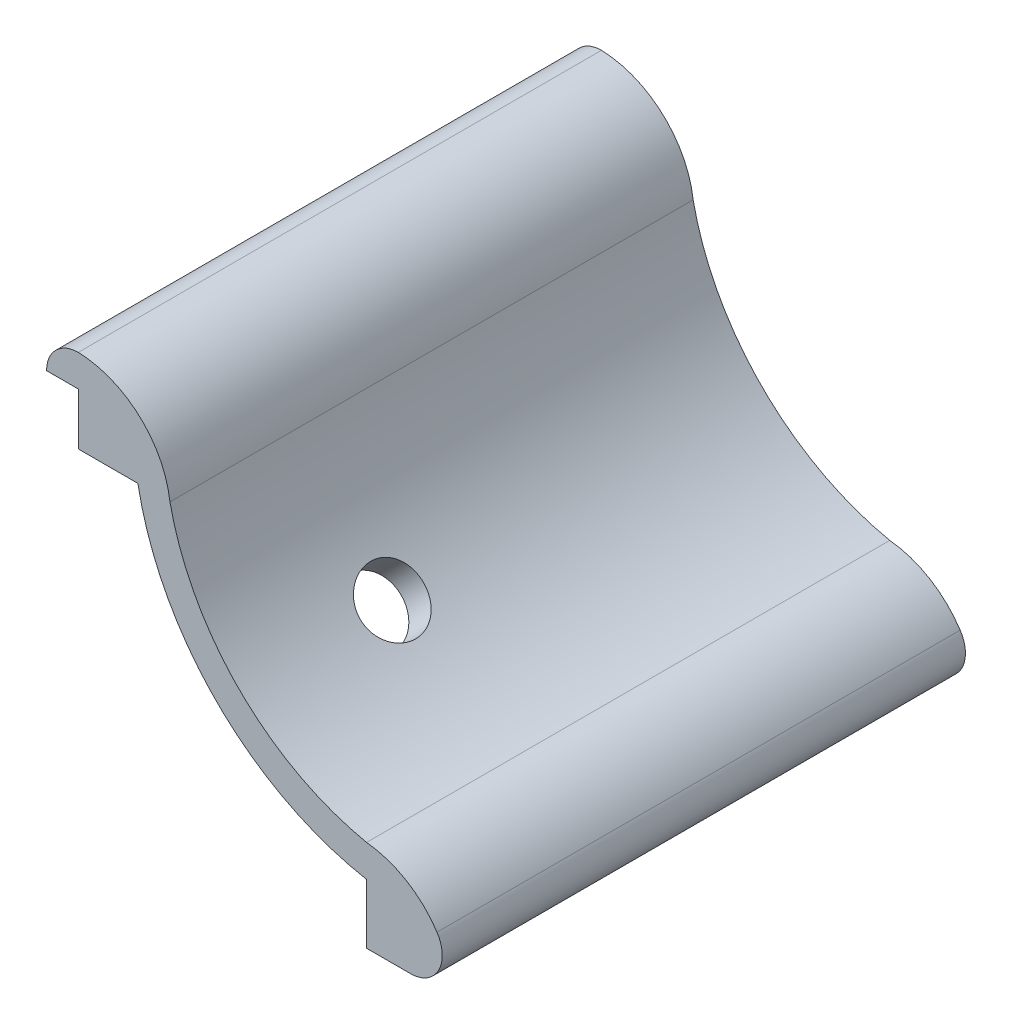
from build123d import *

# Parameters (mm, degrees)
BOSS_EXTRUDE1_DEPTH = 104.775
BOSS_EXTRUDE2_DEPTH = 92.5957
BOSS_EXTRUDE3_START = -5.8293
BOSS_EXTRUDE3_DEPTH = 5.8293
BOSS_EXTRUDE4_DEPTH = 6.35
SKETCH5_W           = 7.787485422
SKETCH5_H           = 19.833751934
SKETCH5_W_2         = 22.754058967
SKETCH5_H_2         = 3.407024872
CUT_EXTRUDE1_DEPTH  = 227.312030137
SKETCH6_R           = 6.35
CUT_EXTRUDE2_DEPTH  = 6.35
SKETCH7_W           = 111.054240747
SKETCH7_H           = 89.646194338
CUT_EXTRUDE3_DEPTH  = 104.775
SKETCH8_W           = 104.775
SKETCH8_H           = 6.354337814
BOSS_EXTRUDE5_DEPTH = 6.35
FILLET1_R           = 6.35


with BuildPart() as part:
    # Sketch1 → Boss-Extrude1 (new, symmetric)
    with BuildSketch(Plane.XY):
        with BuildLine():
            Line((-58.2422, 56.2102), (-58.2422, 62.5602))
            ThreePointArc((-58.2422, 62.5602), (-45.640852469, 57.743322347), (-39.3748699, 45.7962))
            ThreePointArc((-39.3748699, 45.7962), (-25.556268964, 20.239931036), (0, 6.4213301))
            ThreePointArc((0, 6.4213301), (12.247457496, 0.293755183), (17.272, -12.446))
            Line((17.272, -12.446), (10.922, -12.446))
            ThreePointArc((10.922, -12.446), (7.760938146, -4.204686933), (0, 0))
            ThreePointArc((0, 0), (-30.011530905, 15.784669095), (-45.7962, 45.7962))
            ThreePointArc((-45.7962, 45.7962), (-50.144819563, 53.243313205), (-58.2422, 56.2102))
        make_face()
    extrude(amount=BOSS_EXTRUDE1_DEPTH, both=True)


with BuildPart() as boss_extrude2_tool:
    # Sketch2 → Boss-Extrude2 (new, symmetric)
    with BuildSketch(Plane.XY):
        with BuildLine():
            Line((-58.2422, 56.2102), (-58.2422, 45.796198296))
            Line((-58.2422, 45.796198296), (-45.796199685, 45.796198296))
            ThreePointArc((-45.796199685, 45.796198296), (-50.144818899, 53.243312648), (-58.2422, 56.2102))
        make_face()
        with BuildLine():
            Line((0, 0), (0, -12.446))
            Line((0, -12.446), (10.922, -12.446))
            ThreePointArc((10.922, -12.446), (7.760938146, -4.204686933), (0, 0))
        make_face()
    extrude(amount=BOSS_EXTRUDE2_DEPTH, both=True)


with BuildPart() as part_1:
    add(part.part)


with BuildPart() as part_2:
    # Boss-Extrude2: joined with boss_extrude2_tool
    add(part_1.part.fuse(boss_extrude2_tool.part, tol=0.00001))

    # Sketch3 → Boss-Extrude3 (add)
    with BuildSketch(Plane(origin=(0, 0, -104.775), x_dir=(-1, 0, 0), z_dir=(0, 0, -1)).offset(BOSS_EXTRUDE3_START)):
        with BuildLine():
            Line((58.2422, 56.2102), (58.2422, 45.796198296))
            Line((58.2422, 45.796198296), (45.7962, 45.7962))
            ThreePointArc((45.7962, 45.7962), (50.144819563, 53.243313205), (58.2422, 56.2102))
        make_face()
        with BuildLine():
            Line((0, 0), (0, -12.446))
            Line((0, -12.446), (-10.922, -12.446))
            ThreePointArc((-10.922, -12.446), (-7.760938146, -4.204686933), (0, 0))
        make_face()
    extrude(amount=BOSS_EXTRUDE3_DEPTH)

    # Sketch4 → Boss-Extrude4 (add)
    with BuildSketch(Plane.XY.offset(104.775)):
        with BuildLine():
            Line((-58.2422, 56.2102), (-58.2422, 45.796198296))
            Line((-58.2422, 45.796198296), (-45.7962, 45.7962))
            ThreePointArc((-45.7962, 45.7962), (-50.144819563, 53.243313205), (-58.2422, 56.2102))
        make_face()
        with BuildLine():
            Line((0, 0), (0, -12.446))
            Line((0, -12.446), (10.922, -12.446))
            ThreePointArc((10.922, -12.446), (7.760938146, -4.204686933), (0, 0))
        make_face()
    extrude(amount=-BOSS_EXTRUDE4_DEPTH)

    # Sketch5 → Cut-Extrude1 (cut, through all)
    with BuildSketch(Plane.XY.offset(104.775)):
        with Locations((-61.627942711, 54.680509116)):
            Rectangle(SKETCH5_W, SKETCH5_H)
        with Locations((8.225058429, -13.641512436)):
            Rectangle(SKETCH5_W_2, SKETCH5_H_2)
    extrude(amount=-CUT_EXTRUDE1_DEPTH, mode=Mode.SUBTRACT)

    # Sketch6 → Cut-Extrude2 (cut, symmetric)
    with BuildSketch(Plane(origin=(-5.969, -5.969000176, 0), x_dir=(-0.7071067916239179, 0.7071067707491772, 0), z_dir=(-0.7071067707491772, -0.7071067916239179, 0))):
        with Locations(Location((32.382802858, -74.165398348, 0), (0, 0, 180))):
            Circle(SKETCH6_R)
    extrude(amount=CUT_EXTRUDE2_DEPTH, both=True, mode=Mode.SUBTRACT)

    # Sketch7 → Cut-Extrude3 (cut)
    with BuildSketch(Plane(origin=(0, 0, -104.775), x_dir=(-1, 0, 0), z_dir=(0, 0, -1))):
        with Locations((26.053941981, 26.416451063)):
            Rectangle(SKETCH7_W, SKETCH7_H)
    extrude(amount=-CUT_EXTRUDE3_DEPTH, mode=Mode.SUBTRACT)

    # Sketch8 → Boss-Extrude5 (add)
    with BuildSketch(Plane.ZY.offset(57.7342)):
        with Locations((52.3875, 59.374341949)):
            Rectangle(SKETCH8_W, SKETCH8_H)
    extrude(amount=BOSS_EXTRUDE5_DEPTH)

    # Fillet1
    # the kernel refuses this fillet: 6.35 mm, written as the material it takes off along each edge
    with BuildSketch(Plane(origin=(-64.0842, 62.551510856, -15.875), x_dir=(1, 0, 0), z_dir=(0, 0, 1))) as fillet1_piece_1:
        with BuildLine():
            CenterArc((FILLET1_R, -FILLET1_R), FILLET1_R, 90, 90)
            Line((0, -FILLET1_R), (0, 0))
            Line((0, 0), (FILLET1_R, 0))
        make_face()
    extrude(amount=136.525, mode=Mode.SUBTRACT)
    with BuildSketch(Plane(origin=(17.260151367, -11.938, -25.849178653), x_dir=(-0.30497213299383213, 0.9523612749882223, 0), z_dir=(0, 0, 1))) as fillet1_piece_2:
        with BuildLine():
            CenterArc((8.625598356, 6.114282737), FILLET1_R, 162.243512631, 123.416753829)
            Line((2.57810426, 8.050855782), (0, 0))
            ThreePointArc((0, 0), (5.169835731, -0.710949564), (10.339671461, 0))
        make_face()
    extrude(amount=156.473357306, mode=Mode.SUBTRACT)


solid = part_2.part
